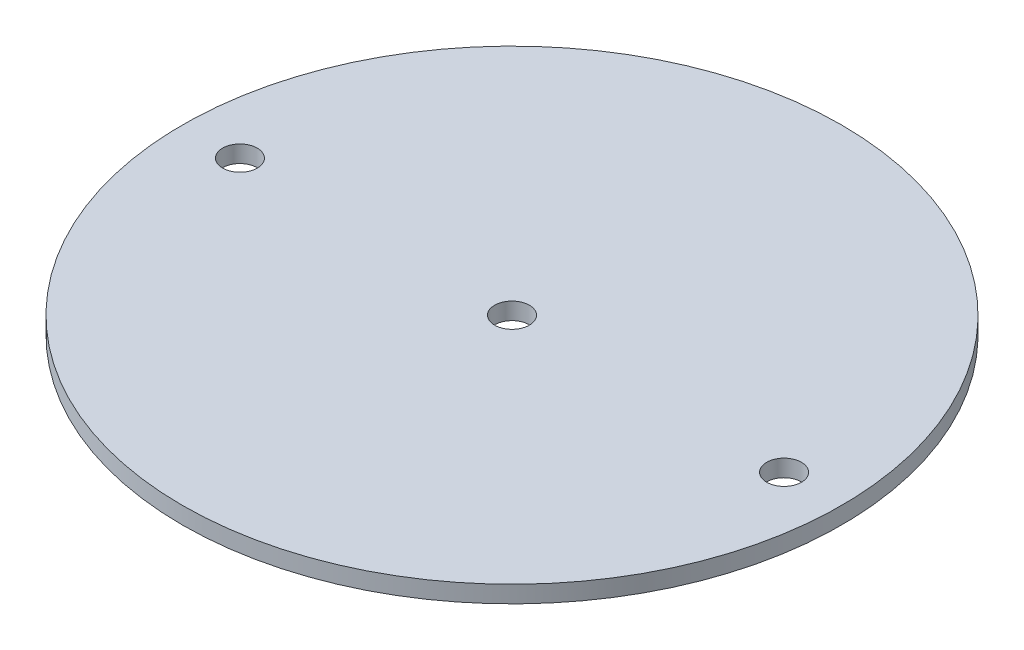
from build123d import *

# Parameters (mm, degrees)
SKETCH2_R           = 61.5315
SKETCH2_R_2         = 3.2385
BOSS_EXTRUDE1_DEPTH = 3.175


with BuildPart() as part:
    # Sketch2 → Boss-Extrude1 (new body)
    with BuildSketch(Plane(origin=(0, 0, 0), x_dir=(1, 0, 0), z_dir=(0, 1, 0))):
        Circle(SKETCH2_R)
        with Locations((-50.8, 0)):
            Circle(SKETCH2_R_2, mode=Mode.SUBTRACT)
        with Locations((50.8, 0)):
            Circle(SKETCH2_R_2, mode=Mode.SUBTRACT)
        Circle(SKETCH2_R_2, mode=Mode.SUBTRACT)
    extrude(amount=BOSS_EXTRUDE1_DEPTH)


solid = part.part
